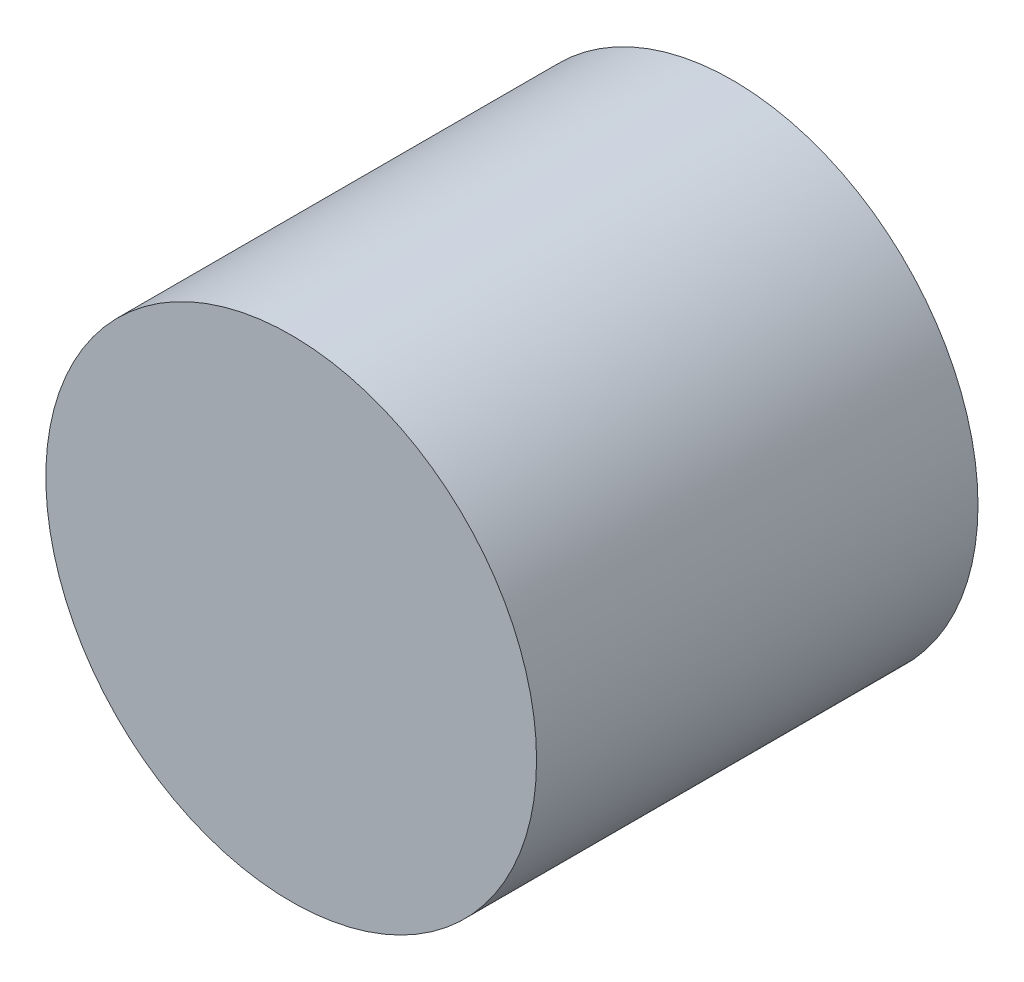
from build123d import *

# Parameters (mm, degrees)
SKETCH1_R           = 38.075
BOSS_EXTRUDE1_DEPTH = 68.5
SKETCH2_R           = 11.5
BOSS_EXTRUDE2_DEPTH = 6
CHAMFER1_SIZE       = 2
SKETCH3_R           = 21.075
CUT_EXTRUDE1_DEPTH  = 3


with BuildPart() as part:
    # Sketch1 → Boss-Extrude1 (new body)
    with BuildSketch(Plane.XY):
        Circle(SKETCH1_R)
    extrude(amount=BOSS_EXTRUDE1_DEPTH)

    # Sketch2 → Boss-Extrude2 (add)
    with BuildSketch(Plane(origin=(0, 0, 0), x_dir=(-1, 0, 0), z_dir=(0, 0, -1))):
        Circle(SKETCH2_R)
    extrude(amount=BOSS_EXTRUDE2_DEPTH)

    # Chamfer1
    chamfer1_edges = [part.edges().sort_by_distance(p)[0] for p in [
        (11.5, 0, -6),
    ]]
    chamfer(chamfer1_edges, length=CHAMFER1_SIZE)

    # Sketch3 → Cut-Extrude1 (cut)
    with BuildSketch(Plane(origin=(0, 0, 0), x_dir=(-1, 0, 0), z_dir=(0, 0, -1))):
        Circle(SKETCH3_R)
    extrude(amount=-CUT_EXTRUDE1_DEPTH, mode=Mode.SUBTRACT)


with BuildPart() as cut_extrude1_piece_1:
    # of the separate pieces the step leaves, piece 1, a body of its own (cut_extrude1_pieces)
    add(part.part.solids().sort_by_distance((38.075, 0, 0))[0])


with BuildPart() as cut_extrude1_piece_2:
    # of the separate pieces the step leaves, piece 2, a body of its own (cut_extrude1_pieces)
    add(part.part.solids().sort_by_distance((-11.5, 0, -4))[0])


solid = Compound([cut_extrude1_piece_1.part, cut_extrude1_piece_2.part])
